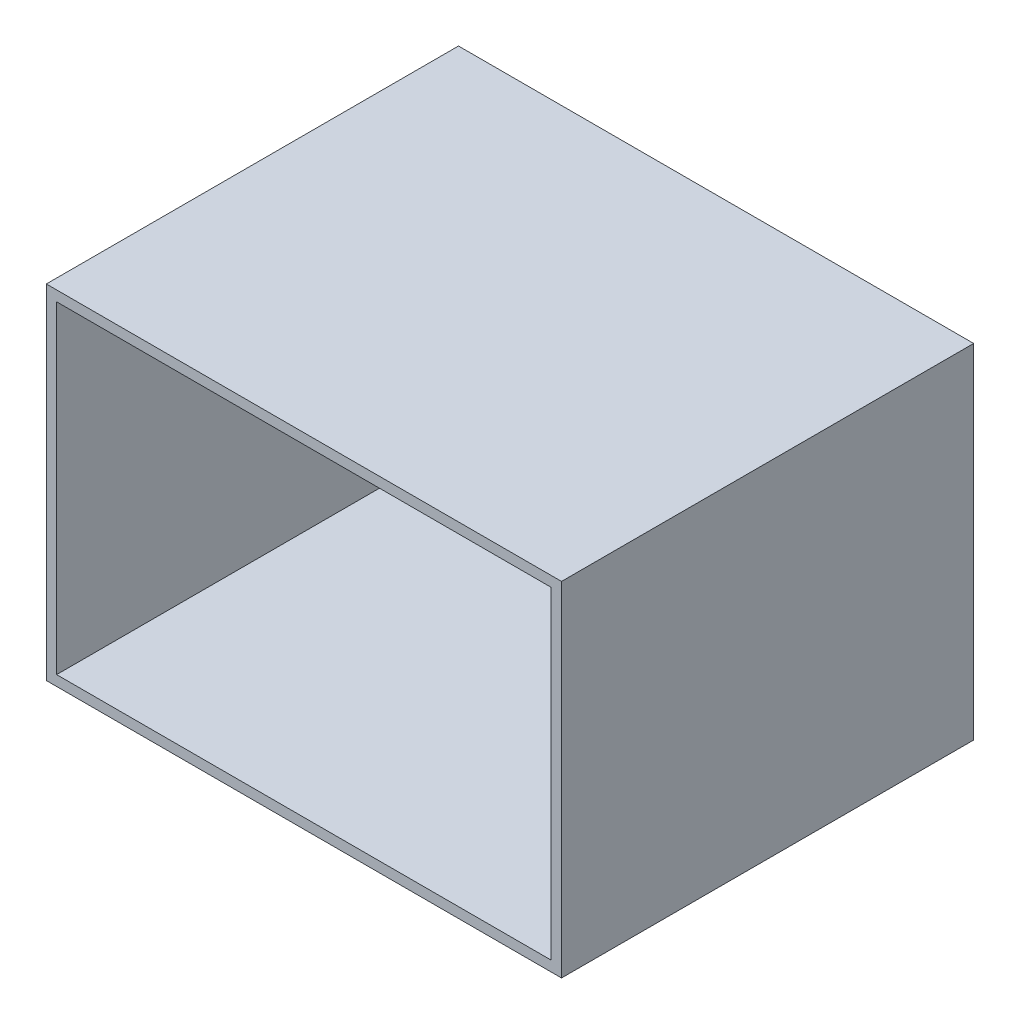
from build123d import *

# Parameters (mm, degrees)
ESQUISSE1_W             = 150
ESQUISSE1_H             = 100
BOSS_EXTRU_1_DEPTH      = 120
ESQUISSE2_W             = 144
ESQUISSE2_H             = 94
ENL_V_MAT_EXTRU_1_DEPTH = 117


with BuildPart() as part:
    # Esquisse1 → Boss.-Extru.1 (new body)
    with BuildSketch(Plane.XY):
        with Locations((0, -1.624405705)):
            Rectangle(ESQUISSE1_W, ESQUISSE1_H)
    extrude(amount=BOSS_EXTRU_1_DEPTH)

    # Esquisse2 → Enlèv. mat.-Extru.1 (cut)
    with BuildSketch(Plane.XY.offset(120)):
        with Locations((0, -1.624405705)):
            Rectangle(ESQUISSE2_W, ESQUISSE2_H)
    extrude(amount=-ENL_V_MAT_EXTRU_1_DEPTH, mode=Mode.SUBTRACT)


solid = part.part
